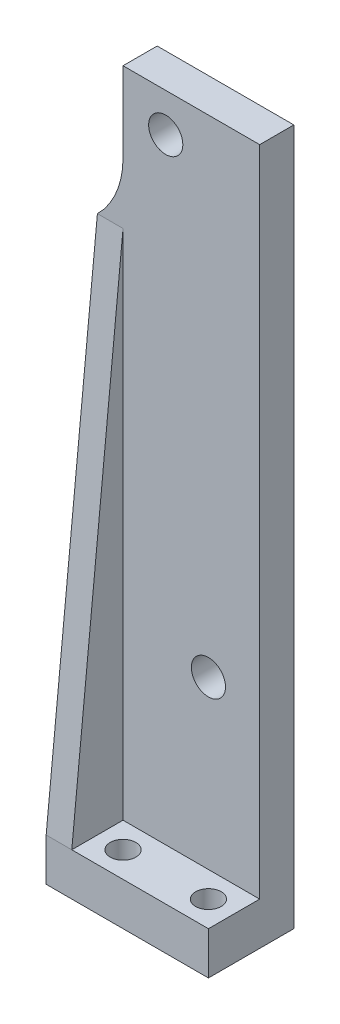
from build123d import *

# Parameters (mm, degrees)
SKETCH_1_W          = 16
SKETCH_1_H          = 6
SKETCH_1_R          = 1.5
EXTRUDE_1_DEPTH     = 5
SKETCH_2_W          = 16
SKETCH_2_H          = 81.5
EXTRUDE_2_DEPTH     = 4
SKETCH_3_R          = 2
CUT_EXTRUDE_1_DEPTH = 83.717894074
SKETCH_4_R          = 2
CUT_EXTRUDE_2_DEPTH = 83.717894074
SKETCH_5_R          = 3.5
CUT_EXTRUDE_3_DEPTH = 1
EXTRUDE_3_DEPTH     = 3
FILLET_1_R          = 10


with BuildPart() as part:
    # 草图1 → 凸台-拉伸1 (new body)
    with BuildSketch(Plane(origin=(0, 0, 0), x_dir=(1, 0, 0), z_dir=(0, 1, 0))):
        with Locations((-2, 0)):
            Rectangle(SKETCH_1_W, SKETCH_1_H)
        with Locations(Location((-7, 0, 0), (0, 0, 270))):
            Circle(SKETCH_1_R, mode=Mode.SUBTRACT)
        with Locations(Location((3, 0, 0), (0, 0, 270))):
            Circle(SKETCH_1_R, mode=Mode.SUBTRACT)
    extrude(amount=EXTRUDE_1_DEPTH)

    # 草图2 → 凸台-拉伸2 (add)
    with BuildSketch(Plane(origin=(0, 0, -3), x_dir=(-1, 0, 0), z_dir=(0, 0, -1))):
        with Locations((2, 40.75)):
            Rectangle(SKETCH_2_W, SKETCH_2_H)
    extrude(amount=EXTRUDE_2_DEPTH)

    # 草图3 → 切除-拉伸1 (cut, through all)
    with BuildSketch(Plane(origin=(0, 0, -7), x_dir=(-1, 0, 0), z_dir=(0, 0, -1))):
        with Locations((5, 77)):
            Circle(SKETCH_3_R)
    extrude(amount=-CUT_EXTRUDE_1_DEPTH, mode=Mode.SUBTRACT)

    # 草图4 → 切除-拉伸2 (cut, through all)
    with BuildSketch(Plane(origin=(0, 0, -7), x_dir=(-1, 0, 0), z_dir=(0, 0, -1))):
        with Locations((0, 24.5)):
            Circle(SKETCH_4_R)
    extrude(amount=-CUT_EXTRUDE_2_DEPTH, mode=Mode.SUBTRACT)

    # 草图5 → 切除-拉伸3 (cut)
    with BuildSketch(Plane(origin=(0, 0, -7), x_dir=(-1, 0, 0), z_dir=(0, 0, -1))):
        with Locations((5, 77)):
            Circle(SKETCH_5_R)
    extrude(amount=-CUT_EXTRUDE_3_DEPTH, mode=Mode.SUBTRACT)

    # 草图6 → 凸台-拉伸3 (add)
    with BuildSketch(Plane.ZY.offset(10)):
        Polygon((3, 5), (-3, 5), (-3, 65), (-7, 65), (-7, 0), (3, 0), align=None)
        Polygon((-3, 65), (-3, 5), (3, 5), align=None)
    extrude(amount=EXTRUDE_3_DEPTH)

    # 圆角1
    # the kernel refuses this fillet: 10 mm, written as the material it adds along each edge
    with BuildSketch(Plane(origin=(-10, 65, -3), x_dir=(-1, 0, 0), z_dir=(0, 0, -1))) as fillet_1_piece_1:
        with BuildLine():
            CenterArc((10, 7.141428429), FILLET_1_R, 180, 45.572995999)
            Line((0, 7.141428429), (0, 0))
            Line((0, 0), (3, 0))
        make_face()
    extrude(amount=4)


solid = part.part
